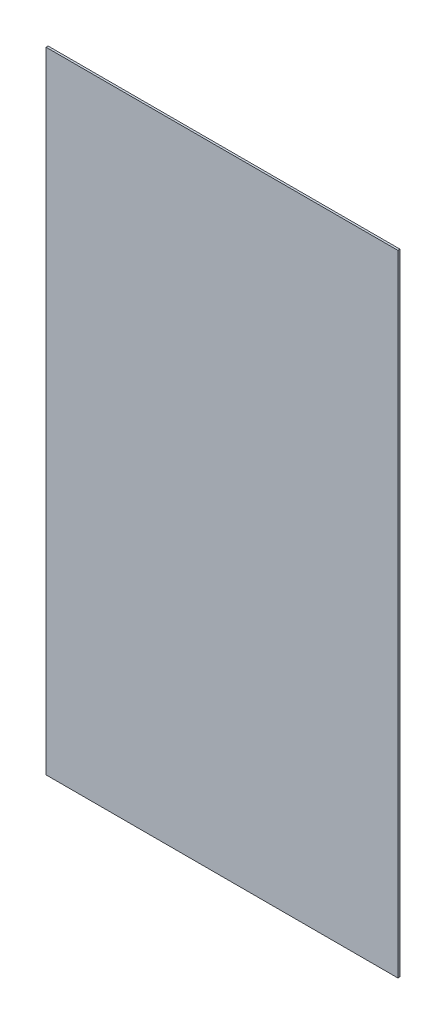
from build123d import *

# Parameters (mm, degrees)
SKETCH2_W           = 530.8
SKETCH2_H           = 950.8
BOSS_EXTRUDE1_DEPTH = 3.175


with BuildPart() as part:
    # Sketch2 → Boss-Extrude1 (new body)
    with BuildSketch(Plane.XY):
        Rectangle(SKETCH2_W, SKETCH2_H)
    extrude(amount=BOSS_EXTRUDE1_DEPTH)


solid = part.part
